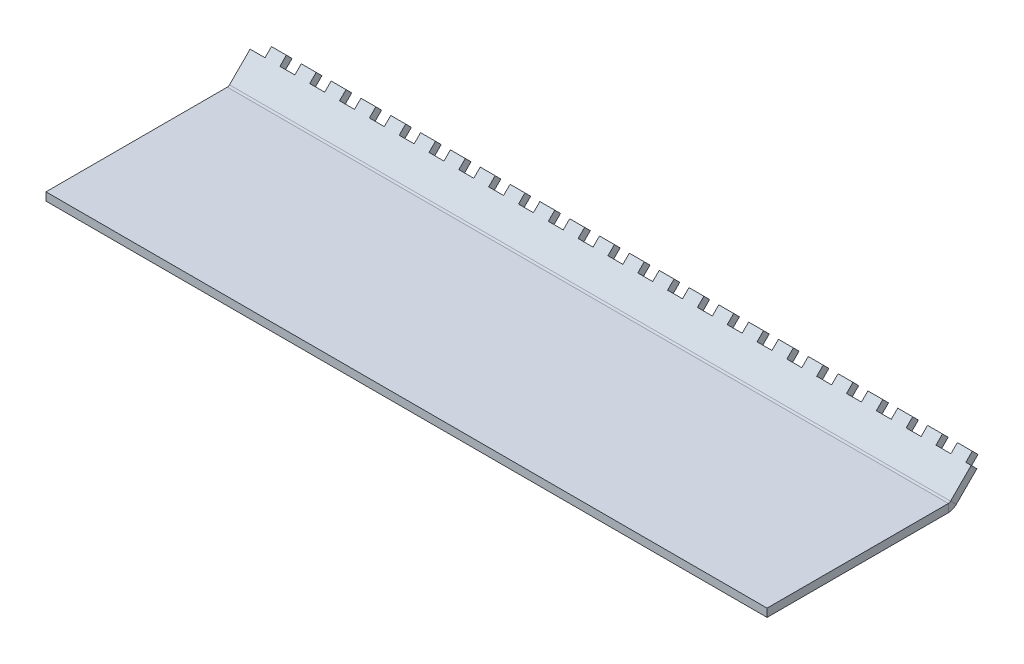
from build123d import *

# Parameters (mm, degrees)
SKETCH1_W                    = 240
SKETCH1_H                    = 2.65684
BASE_FLANGE1_DEPTH           = 60
EDGE_FLANGE1_STRIP_CUT_DEPTH = 240
EDGE_FLANGE1_DEPTH           = 240
EDGE_FLANGE1_START           = 2.65684
EDGE_FLANGE1_FLAT_DEPTH      = 2.65684
CUT_EXTRUDE1_DEPTH           = 33.782
CUT_EXTRUDE1_DEPTH_BACK      = 23.876


# Sheet-metal steps are written as plain solids
with BuildPart() as part:
    # Sketch1 → Base-Flange1 (new body)
    with BuildSketch(Plane.XY):
        with Locations((0, -1.32842)):
            Rectangle(SKETCH1_W, SKETCH1_H)
    extrude(amount=BASE_FLANGE1_DEPTH)

    # Edge-Flange1 strip (across the edge) → Edge-Flange1 strip cut (cut)
    with BuildSketch(Plane(origin=(120, 0, 0), x_dir=(0, 0.7071067811865512, 0.7071067811865438), z_dir=(-1, 0, 0))):
        Polygon((-10.514668246, 6.757329085), (-1.585776362, -2.171562799), (0.292893219, -0.292893219), (-8.635998666, 8.635998666), align=None)
    extrude(amount=EDGE_FLANGE1_STRIP_CUT_DEPTH, mode=Mode.SUBTRACT)

    # Edge-Flange1 bend section (across the edge) → Edge-Flange1 (add)
    with BuildSketch(Plane(origin=(120, 0, 0), x_dir=(0, 0.7071067811865512, 0.7071067811865438), z_dir=(-1, 0, 0))):
        with BuildLine():
            Line((-2.65684, 0.414213562), (0, 0.414213562))
            ThreePointArc((0, 0.414213562), (0.076120467, 0.03153013), (0.292893219, -0.292893219))
            Line((0.292893219, -0.292893219), (-1.585776362, -2.171562799))
            ThreePointArc((-1.585776362, -2.171562799), (-2.37847963, -0.98519852), (-2.65684, 0.414213562))
        make_face()
    extrude(amount=EDGE_FLANGE1_DEPTH)

    # Edge-Flange1 profile (on flange) → Edge-Flange1 flat (add)
    with BuildSketch(Plane(origin=(0, 0, 0), x_dir=(-1, 0, 0), z_dir=(0, -0.7071067811865512, -0.7071067811865438)).offset(EDGE_FLANGE1_START)):
        Polygon((120, 0.414213562), (120, 10), (115.1, 10), (115.1, 13), (110.2, 13), (110.2, 10), (105.3, 10), (105.3, 13), (100.4, 13), (100.4, 10), (95.5, 10), (95.5, 13), (90.6, 13), (90.6, 10), (85.7, 10), (85.7, 13), (80.8, 13), (80.8, 10), (75.9, 10), (75.9, 13), (71, 13), (71, 10), (66.1, 10), (66.1, 13), (61.2, 13), (61.2, 10), (56.3, 10), (56.3, 13), (51.4, 13), (51.4, 10), (46.5, 10), (46.5, 13), (41.6, 13), (41.6, 10), (36.7, 10), (36.7, 13), (31.8, 13), (31.8, 10), (26.9, 10), (26.9, 13), (22, 13), (22, 10), (17.1, 10), (17.1, 13), (12.2, 13), (12.2, 10), (7.3, 10), (7.3, 13), (2.4, 13), (2.4, 10), (-2.5, 10), (-2.5, 13), (-7.4, 13), (-7.4, 10), (-12.3, 10), (-12.3, 13), (-17.2, 13), (-17.2, 10), (-22.1, 10), (-22.1, 13), (-27, 13), (-27, 10), (-31.9, 10), (-31.9, 13), (-36.8, 13), (-36.8, 10), (-41.7, 10), (-41.7, 13), (-46.6, 13), (-46.6, 10), (-51.5, 10), (-51.5, 13), (-56.4, 13), (-56.4, 10), (-61.3, 10), (-61.3, 13), (-66.2, 13), (-66.2, 10), (-71.1, 10), (-71.1, 13), (-76, 13), (-76, 10), (-80.9, 10), (-80.9, 13), (-85.8, 13), (-85.8, 10), (-90.7, 10), (-90.7, 13), (-95.6, 13), (-95.6, 10), (-100.5, 10), (-100.5, 13), (-105.4, 13), (-105.4, 10), (-110.3, 10), (-110.3, 13), (-115.2, 13), (-115.2, 10), (-120, 10), (-120, 0.414213562), align=None)
    extrude(amount=-EDGE_FLANGE1_FLAT_DEPTH)

    # Sketch9 → Cut-Extrude1 (cut, two sides: drawn at the far end of the back side and taken through both)
    with BuildSketch(Plane(origin=(0, 0, 0), x_dir=(1, 0, 0), z_dir=(0, 1, 0)).offset(-CUT_EXTRUDE1_DEPTH_BACK)):
        Polygon((120, -60), (120, 40.593867323), (116.952, 40.593867323), (116.952, -75.248845782), (120, -75.248845782), align=None)
    extrude(amount=CUT_EXTRUDE1_DEPTH + CUT_EXTRUDE1_DEPTH_BACK, mode=Mode.SUBTRACT)


solid = part.part
